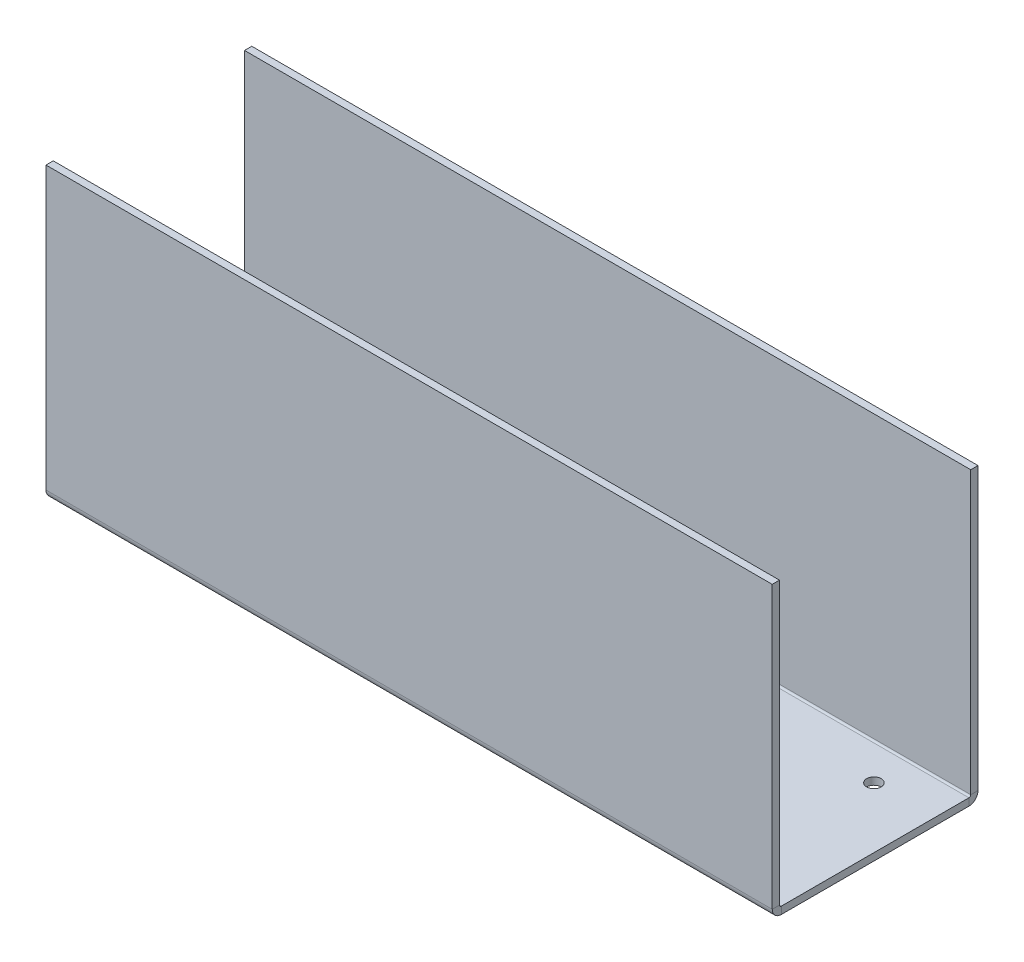
from build123d import *

# Parameters (mm, degrees)
SKETCH1_W                      = 300
SKETCH1_H                      = 85
BASE_FLANGE2_DEPTH             = 3
EDGE_FLANGE1_STRIP_W           = 13.4732
EDGE_FLANGE1_STRIP_H           = 3
EDGE_FLANGE1_STRIP_CUT_DEPTH   = 300
EDGE_FLANGE1_STRIP_2_W         = 13.4732
EDGE_FLANGE1_STRIP_2_H         = 3
EDGE_FLANGE1_STRIP_CUT_2_DEPTH = 300
EDGE_FLANGE1_DEPTH             = 300
EDGE_FLANGE1_BEND_DEPTH        = 300
SKETCH17_R                     = 3
CUT_EXTRUDE1_DEPTH             = 10


# Sheet-metal steps are written as plain solids
with BuildPart() as part:
    # Sketch1 → Base-Flange2 (new body)
    with BuildSketch(Plane(origin=(0, 0, 0), x_dir=(1, 0, 0), z_dir=(0, 1, 0))):
        Rectangle(SKETCH1_W, SKETCH1_H)
    extrude(amount=-BASE_FLANGE2_DEPTH)

    # Edge-Flange1 strip (across the edge) → Edge-Flange1 strip cut (cut)
    with BuildSketch(Plane(origin=(-150, 0, 42.5), x_dir=(0, 0, -1), z_dir=(1, 0, 0))):
        with Locations((-3, -1.5)):
            Rectangle(EDGE_FLANGE1_STRIP_W, EDGE_FLANGE1_STRIP_H)
    extrude(amount=EDGE_FLANGE1_STRIP_CUT_DEPTH, mode=Mode.SUBTRACT)

    # Edge-Flange1 strip 2 (across the edge) → Edge-Flange1 strip cut 2 (cut)
    with BuildSketch(Plane(origin=(150, 0, -42.5), x_dir=(0, 0, 1), z_dir=(-1, 0, 0))):
        with Locations((-3, -1.5)):
            Rectangle(EDGE_FLANGE1_STRIP_2_W, EDGE_FLANGE1_STRIP_2_H)
    extrude(amount=EDGE_FLANGE1_STRIP_CUT_2_DEPTH, mode=Mode.SUBTRACT)

    # Edge-Flange1 section (across the edge) → Edge-Flange1 (add)
    with BuildSketch(Plane(origin=(-150, 0, 42.5), x_dir=(0, 0, -1), z_dir=(1, 0, 0))):
        with BuildLine():
            Line((0, 0.7366), (0, 117))
            Line((0, 117), (3, 117))
            Line((3, 117), (3, 0.7366))
            ThreePointArc((3, 0.7366), (3.215745145, 0.215745145), (3.7366, 0))
            Line((3.7366, 0), (3.7366, -3))
            ThreePointArc((3.7366, -3), (1.094424801, -1.905575199), (0, 0.7366))
        make_face()
    extrude(amount=EDGE_FLANGE1_DEPTH)

    # Edge-Flange1 section 2 (across the edge) → Edge-Flange1 bend (add)
    with BuildSketch(Plane(origin=(150, 0, -42.5), x_dir=(0, 0, 1), z_dir=(-1, 0, 0))):
        with BuildLine():
            Line((0, 0.7366), (0, 117))
            Line((0, 117), (3, 117))
            Line((3, 117), (3, 0.7366))
            ThreePointArc((3, 0.7366), (3.215745145, 0.215745145), (3.7366, 0))
            Line((3.7366, 0), (3.7366, -3))
            ThreePointArc((3.7366, -3), (1.094424801, -1.905575199), (0, 0.7366))
        make_face()
    extrude(amount=EDGE_FLANGE1_BEND_DEPTH)

    # Sketch17 → Cut-Extrude1 (cut)
    with BuildSketch(Plane(origin=(0, 0, 0), x_dir=(1, 0, 0), z_dir=(0, 1, 0))):
        with Locations(Location((-125, 24.5, 0), (0, 0, 270))):
            Circle(SKETCH17_R)
        with Locations(Location((-125, -20.5, 0), (0, 0, 270))):
            Circle(SKETCH17_R)
        with Locations(Location((125, 24.5, 0), (0, 0, 270))):
            Circle(SKETCH17_R)
        with Locations(Location((125, -20.5, 0), (0, 0, 270))):
            Circle(SKETCH17_R)
    extrude(amount=-CUT_EXTRUDE1_DEPTH, mode=Mode.SUBTRACT)


solid = part.part
